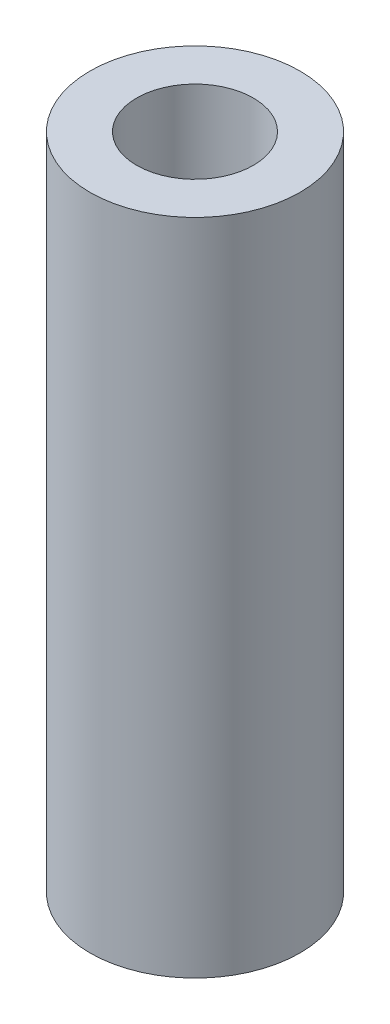
from build123d import *

# Parameters (mm, degrees)
SZKIC1_W = 28
SZKIC1_H = 395


with BuildPart() as part:
    # Szkic1 → Obrót1 (revolve)
    with BuildSketch(Plane.XY):
        with Locations((49, 0)):
            Rectangle(SZKIC1_W, SZKIC1_H)
    revolve(axis=Axis((0, 344.744344029, 0), (0, -1, 0)))


solid = part.part
